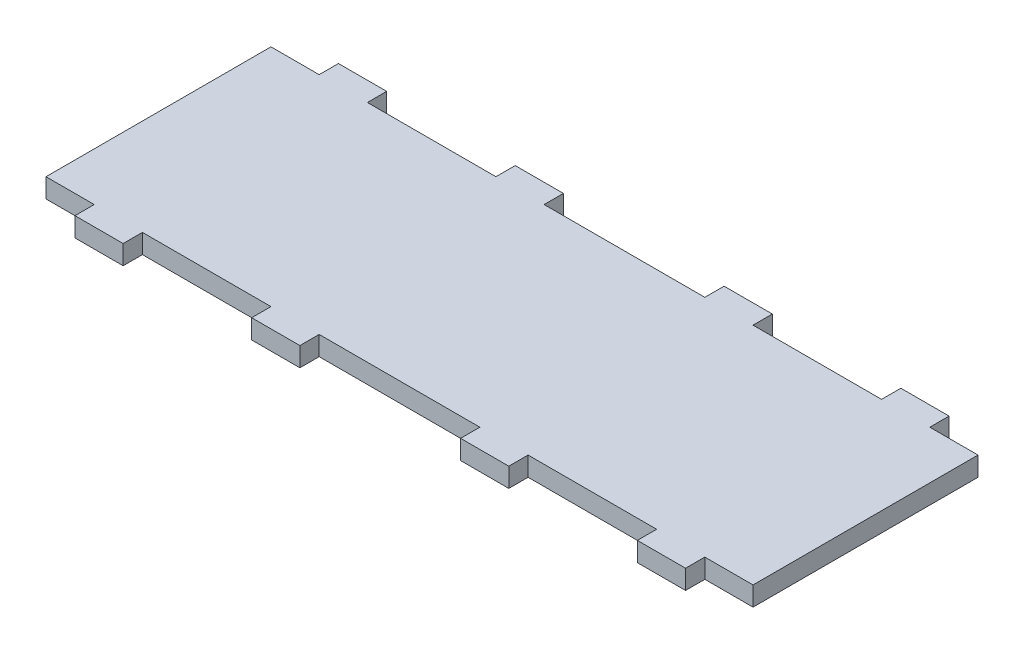
from build123d import *

# Parameters (mm, degrees)
BOSS_EXTRUDE1_DEPTH = 6


with BuildPart() as part:
    # Sketch1 → Boss-Extrude1 (new body)
    with BuildSketch(Plane(origin=(0, 0, 0), x_dir=(1, 0, 0), z_dir=(0, 1, 0))):
        Polygon((-160.386748432, 60.5), (-145.386748432, 60.5), (-145.386748432, -9.5), (-160.386748432, -9.5), (-160.386748432, -15.5), (-175.386748432, -15.5), (-175.386748432, -9.5), (-215.386748432, -9.5), (-215.386748432, -15.5), (-230.386748432, -15.5), (-230.386748432, -9.5), (-280.386748432, -9.5), (-280.386748432, -15.5), (-295.386748432, -15.5), (-295.386748432, -9.5), (-335.386748432, -9.5), (-335.386748432, -15.5), (-350.386748432, -15.5), (-350.386748432, -9.5), (-365.386748432, -9.5), (-365.386748432, 60.5), (-350.386748432, 60.5), (-350.386748432, 66.5), (-335.386748432, 66.5), (-335.386748432, 60.5), (-295.386748432, 60.5), (-295.386748432, 66.5), (-280.386748432, 66.5), (-280.386748432, 60.5), (-230.386748432, 60.5), (-230.386748432, 66.5), (-215.386748432, 66.5), (-215.386748432, 60.5), (-175.386748432, 60.5), (-175.386748432, 66.5), (-160.386748432, 66.5), align=None)
    extrude(amount=BOSS_EXTRUDE1_DEPTH)


solid = part.part
